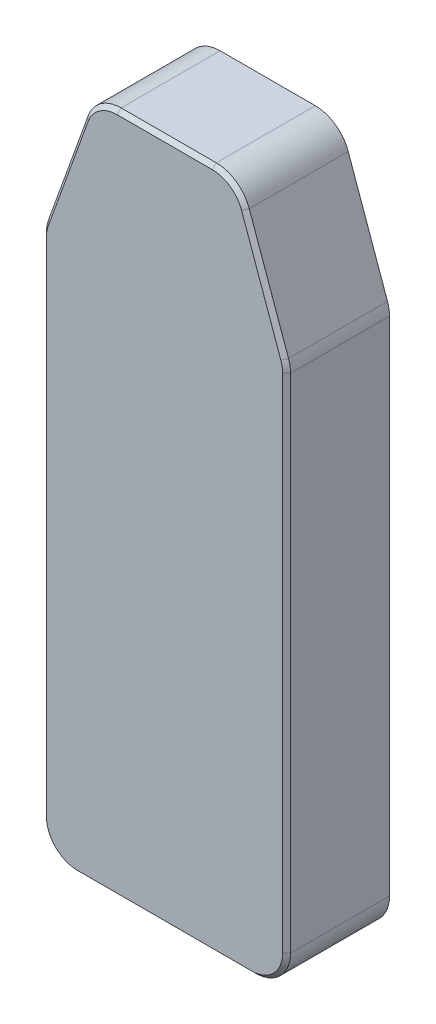
from build123d import *

# Parameters (mm, degrees)
BOSS_EXTRUDE1_DEPTH = 36
BOSS_EXTRUDE2_DEPTH = 3
CHAMFER1_SIZE       = 1.5


with BuildPart() as part:
    # Sketch1 → Boss-Extrude1 (new body)
    with BuildSketch(Plane.XY):
        with BuildLine():
            ThreePointArc((33, -126.25), (42.369164851, -122.369164851), (46.25, -113))
            Line((46.25, -113), (46.25, 77.269287137))
            ThreePointArc((46.25, 77.269287137), (46.055906569, 79.528889681), (45.479312656, 81.722292374))
            Line((45.479312656, 81.722292374), (30.588501914, 123.453005237))
            ThreePointArc((30.588501914, 123.453005237), (25.743329046, 129.829700351), (18.109189258, 132.25))
            Line((18.109189258, 132.25), (-17.946852503, 132.25))
            ThreePointArc((-17.946852503, 132.25), (-25.56302687, 129.842342367), (-30.411330997, 123.494360454))
            Line((-30.411330997, 123.494360454), (-45.464478493, 81.746566714))
            ThreePointArc((-45.464478493, 81.746566714), (-46.052142354, 79.53345153), (-46.25, 77.25220626))
            Line((-46.25, 77.25220626), (-46.25, -113))
            ThreePointArc((-46.25, -113), (-42.369164851, -122.369164851), (-33, -126.25))
            Line((-33, -126.25), (33, -126.25))
        make_face()
        with BuildLine():
            ThreePointArc((-43.25, 77.25220626), (-43.096940311, 79.016943167), (-42.642332419, 80.728975668))
            Line((-42.642332419, 80.728975668), (-27.589184923, 122.476769408))
            ThreePointArc((-27.589184923, 122.476769408), (-23.838610033, 127.387472397), (-17.946852503, 129.25))
            Line((-17.946852503, 129.25), (18.109189258, 129.25))
            ThreePointArc((18.109189258, 129.25), (24.014844566, 127.377692725), (27.762997162, 122.444777636))
            Line((27.762997162, 122.444777636), (42.653807903, 80.714064773))
            ThreePointArc((42.653807903, 80.714064773), (43.099852252, 79.017281558), (43.25, 77.269287137))
            Line((43.25, 77.269287137), (43.25, -113))
            ThreePointArc((43.25, -113), (40.247844507, -120.247844507), (33, -123.25))
            Line((33, -123.25), (-33, -123.25))
            ThreePointArc((-33, -123.25), (-40.247844507, -120.247844507), (-43.25, -113))
            Line((-43.25, -113), (-43.25, 77.25220626))
        make_face(mode=Mode.SUBTRACT)
    extrude(amount=BOSS_EXTRUDE1_DEPTH)

    # Sketch3 → Boss-Extrude2 (add)
    with BuildSketch(Plane.XY.offset(36)):
        with BuildLine():
            Line((-46.25, 77.25220626), (-46.25, -113))
            ThreePointArc((-46.25, -113), (-42.369164851, -122.369164851), (-33, -126.25))
            Line((-33, -126.25), (33, -126.25))
            ThreePointArc((33, -126.25), (42.369164851, -122.369164851), (46.25, -113))
            Line((46.25, -113), (46.25, 77.269287137))
            ThreePointArc((46.25, 77.269287137), (46.055906569, 79.528889681), (45.479312656, 81.722292374))
            Line((45.479312656, 81.722292374), (30.588501914, 123.453005237))
            ThreePointArc((30.588501914, 123.453005237), (25.743329046, 129.829700351), (18.109189258, 132.25))
            Line((18.109189258, 132.25), (-17.946852503, 132.25))
            ThreePointArc((-17.946852503, 132.25), (-25.56302687, 129.842342367), (-30.411330997, 123.494360454))
            Line((-30.411330997, 123.494360454), (-45.464478493, 81.746566714))
            ThreePointArc((-45.464478493, 81.746566714), (-46.052142354, 79.53345153), (-46.25, 77.25220626))
        make_face()
    extrude(amount=BOSS_EXTRUDE2_DEPTH)

    # Chamfer1
    chamfer1_edges = [part.edges().sort_by_distance(p)[0] for p in [
        (-37.937904745, 102.620463584, 39),
        (-25.56302687, 129.842342367, 39),
        (0.081168378, 132.25, 39),
        (25.743329046, 129.829700351, 39),
        (38.033907285, 102.587648806, 39),
        (46.055906569, 79.528889681, 39),
        (46.25, -17.865356432, 39),
        (42.369164851, -122.369164851, 39),
        (0, -126.25, 39),
        (-42.369164851, -122.369164851, 39),
        (-46.25, -17.87389687, 39),
        (-46.052142354, 79.53345153, 39),
        (35.208402533, 101.579421205, 0),
        (43.099852252, 79.017281558, 0),
        (24.014844566, 127.377692725, 0),
        (43.25, -17.865356432, 0),
        (0.081168378, 129.25, 0),
        (40.247844507, -120.247844507, 0),
        (-23.838610033, 127.387472397, 0),
        (0, -123.25, 0),
        (-35.115758671, 101.602872538, 0),
        (-40.247844507, -120.247844507, 0),
        (-43.096940311, 79.016943167, 0),
        (-43.25, -17.87389687, 0),
    ]]
    chamfer(chamfer1_edges, length=CHAMFER1_SIZE)


solid = part.part
